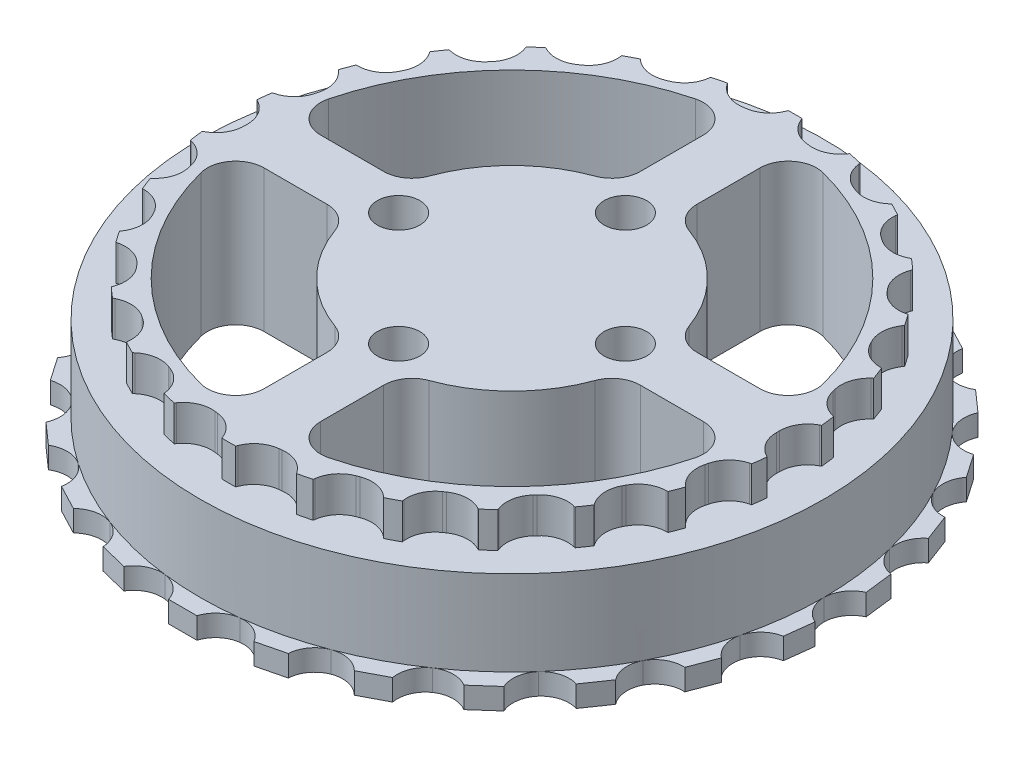
from build123d import *

# Parameters (mm, degrees)
SKETCH1_W                = 4
SKETCH1_H                = 4
BOSS_EXTRUDE1_DEPTH      = 10
FILLET1_R                = 2
BOSS_EXTRUDE2_DEPTH      = 1.5
FILLET2_R                = 2
CIRPATTERN1_COUNT        = 26
FILLET2_OF_CIRPATTERN1_R = 2
CUT_EXTRUDE1_START       = -2.5
CUT_EXTRUDE1_DEPTH       = 2.5
FILLET3_R                = 2
CIRPATTERN2_COUNT        = 26
FILLET3_OF_CIRPATTERN2_R = 2
SKETCH4_R                = 1.5
CUT_EXTRUDE2_DEPTH       = 2.75


with BuildPart() as part:
    # Sketch1 → Boss-Extrude1 (new body)
    with BuildSketch(Plane(origin=(0, 0, 0), x_dir=(1, 0, 0), z_dir=(0, 1, 0))):
        with BuildLine():
            ThreePointArc((2, -21.9089023), (15.556349186, -15.556349186), (21.9089023, -2))
            Line((21.9089023, -2), (17.88854382, -2))
            ThreePointArc((17.88854382, -2), (12.727922061, -12.727922061), (2, -17.88854382))
            Line((2, -17.88854382), (2, -21.9089023))
        make_face()
        with BuildLine():
            ThreePointArc((2, 21.9089023), (0, 22), (-2, 21.9089023))
            Line((-2, 21.9089023), (-2, 17.88854382))
            ThreePointArc((-2, 17.88854382), (0, 18), (2, 17.88854382))
            Line((2, 17.88854382), (2, 21.9089023))
        make_face()
        with BuildLine():
            Line((-2, -17.88854382), (-2, -21.9089023))
            ThreePointArc((-2, -21.9089023), (0, -22), (2, -21.9089023))
            Line((2, -21.9089023), (2, -17.88854382))
            ThreePointArc((2, -17.88854382), (0, -18), (-2, -17.88854382))
        make_face()
        with BuildLine():
            Line((-17.88854382, -2), (-21.9089023, -2))
            ThreePointArc((-21.9089023, -2), (-15.556349186, -15.556349186), (-2, -21.9089023))
            Line((-2, -21.9089023), (-2, -17.88854382))
            ThreePointArc((-2, -17.88854382), (-12.727922061, -12.727922061), (-17.88854382, -2))
        make_face()
        with BuildLine():
            Line((-17.88854382, 2), (-21.9089023, 2))
            ThreePointArc((-21.9089023, 2), (-22, 0), (-21.9089023, -2))
            Line((-21.9089023, -2), (-17.88854382, -2))
            ThreePointArc((-17.88854382, -2), (-18, 0), (-17.88854382, 2))
        make_face()
        with BuildLine():
            ThreePointArc((22, 0), (21.977213775, 1.001036811), (21.9089023, 2))
            Line((21.9089023, 2), (17.88854382, 2))
            ThreePointArc((17.88854382, 2), (17.972114355, 1.001551606), (18, 0))
            ThreePointArc((18, 0), (17.972114355, -1.001551606), (17.88854382, -2))
            Line((17.88854382, -2), (21.9089023, -2))
            ThreePointArc((21.9089023, -2), (21.977213775, -1.001036811), (22, 0))
        make_face()
        with BuildLine():
            Line((-2, 17.88854382), (-2, 21.9089023))
            ThreePointArc((-2, 21.9089023), (-15.556349186, 15.556349186), (-21.9089023, 2))
            Line((-21.9089023, 2), (-17.88854382, 2))
            ThreePointArc((-17.88854382, 2), (-12.727922061, 12.727922061), (-2, 17.88854382))
        make_face()
        with BuildLine():
            ThreePointArc((21.9089023, 2), (15.556349186, 15.556349186), (2, 21.9089023))
            Line((2, 21.9089023), (2, 17.88854382))
            ThreePointArc((2, 17.88854382), (12.727922061, 12.727922061), (17.88854382, 2))
            Line((17.88854382, 2), (21.9089023, 2))
        make_face()
        with BuildLine():
            ThreePointArc((2, 17.88854382), (0, 18), (-2, 17.88854382))
            Line((-2, 17.88854382), (-2, 9.542667342))
            ThreePointArc((-2, 9.542667342), (0, 9.75), (2, 9.542667342))
            Line((2, 9.542667342), (2, 17.88854382))
        make_face()
        with BuildLine():
            Line((-2, -9.542667342), (-2, -17.88854382))
            ThreePointArc((-2, -17.88854382), (0, -18), (2, -17.88854382))
            Line((2, -17.88854382), (2, -9.542667342))
            ThreePointArc((2, -9.542667342), (0, -9.75), (-2, -9.542667342))
        make_face()
        with BuildLine():
            Line((9.542667342, 2), (2, 2))
            Line((2, 2), (2, -2))
            Line((2, -2), (9.542667342, -2))
            ThreePointArc((9.542667342, -2), (9.69802832, -1.005358994), (9.75, 0))
            ThreePointArc((9.75, 0), (9.69802832, 1.005358994), (9.542667342, 2))
        make_face()
        with BuildLine():
            Line((2, -2), (-2, -2))
            Line((-2, -2), (-2, -9.542667342))
            ThreePointArc((-2, -9.542667342), (0, -9.75), (2, -9.542667342))
            Line((2, -9.542667342), (2, -2))
        make_face()
        with BuildLine():
            Line((-9.542667342, 2), (-17.88854382, 2))
            ThreePointArc((-17.88854382, 2), (-18, 0), (-17.88854382, -2))
            Line((-17.88854382, -2), (-9.542667342, -2))
            ThreePointArc((-9.542667342, -2), (-9.75, 0), (-9.542667342, 2))
        make_face()
        with BuildLine():
            ThreePointArc((18, 0), (17.972114355, 1.001551606), (17.88854382, 2))
            Line((17.88854382, 2), (9.542667342, 2))
            ThreePointArc((9.542667342, 2), (9.69802832, 1.005358994), (9.75, 0))
            ThreePointArc((9.75, 0), (9.69802832, -1.005358994), (9.542667342, -2))
            Line((9.542667342, -2), (17.88854382, -2))
            ThreePointArc((17.88854382, -2), (17.972114355, -1.001551606), (18, 0))
        make_face()
        with BuildLine():
            Line((9.542667342, -2), (2, -2))
            Line((2, -2), (2, -9.542667342))
            ThreePointArc((2, -9.542667342), (6.894291117, -6.894291117), (9.542667342, -2))
        make_face()
        with BuildLine():
            Line((-2, -9.542667342), (-2, -2))
            Line((-2, -2), (-9.542667342, -2))
            ThreePointArc((-9.542667342, -2), (-6.894291117, -6.894291117), (-2, -9.542667342))
        make_face()
        with BuildLine():
            Line((-2, -2), (-2, 2))
            Line((-2, 2), (-9.542667342, 2))
            ThreePointArc((-9.542667342, 2), (-9.75, 0), (-9.542667342, -2))
            Line((-9.542667342, -2), (-2, -2))
        make_face()
        with BuildLine():
            ThreePointArc((2, 9.542667342), (0, 9.75), (-2, 9.542667342))
            Line((-2, 9.542667342), (-2, 2))
            Line((-2, 2), (2, 2))
            Line((2, 2), (2, 9.542667342))
        make_face()
        Rectangle(SKETCH1_W, SKETCH1_H)
        with BuildLine():
            ThreePointArc((9.542667342, 2), (6.894291117, 6.894291117), (2, 9.542667342))
            Line((2, 9.542667342), (2, 2))
            Line((2, 2), (9.542667342, 2))
        make_face()
        with BuildLine():
            Line((-2, 2), (-2, 9.542667342))
            ThreePointArc((-2, 9.542667342), (-6.894291117, 6.894291117), (-9.542667342, 2))
            Line((-9.542667342, 2), (-2, 2))
        make_face()
    extrude(amount=BOSS_EXTRUDE1_DEPTH)

    # Fillet1
    fillet1_edges = [part.edges().sort_by_distance(p)[0] for p in [
        (17.88854382, 5, 2),
        (9.542667342, 5, 2),
        (2, 5, 9.542667342),
        (2, 5, 17.88854382),
        (2, 5, -9.542667342),
        (9.542667342, 5, -2),
        (17.88854382, 5, -2),
        (2, 5, -17.88854382),
        (-2, 5, 17.88854382),
        (-2, 5, 9.542667342),
        (-9.542667342, 5, 2),
        (-17.88854382, 5, 2),
        (-17.88854382, 5, -2),
        (-9.542667342, 5, -2),
        (-2, 5, -9.542667342),
        (-2, 5, -17.88854382),
    ]]
    fillet(fillet1_edges, radius=FILLET1_R)

    # Sketch2 → Boss-Extrude2 (add)
    with BuildSketch(Plane.XZ):
        with BuildLine():
            Line((1, 23.227260976), (-1, 23.227260976))
            Line((-1, 23.227260976), (-1, 21.977260976))
            ThreePointArc((-1, 21.977260976), (0, 22), (1, 21.977260976))
            Line((1, 21.977260976), (1, 23.227260976))
        make_face()
    boss_extrude2 = extrude(amount=-BOSS_EXTRUDE2_DEPTH)

    # Fillet2
    # the kernel refuses this fillet: 2 mm, written as the material it adds along each edge
    with BuildSketch(Plane(origin=(-1, 0, 21.977260976), x_dir=(-0.9965164866079756, 0, -0.0833959946190231), z_dir=(0, 1, 0))) as fillet2_piece_1:
        with BuildLine():
            CenterArc((1.748625289, 1.998554444), FILLET2_R, 202.11423331, 65.70722334)
            Line((-0.104244993, 1.245645608), (-0.141302399, 1.230587432))
            ThreePointArc((-0.141302399, 1.230587432), (-0.091983156, 0.619486964), (-0.039860659, -0.00333584))
            Line((-0.039860659, -0.00333584), (0.001520544, -0.039971089))
            ThreePointArc((0.001520544, -0.039971089), (0.836299051, -0.024098888), (1.671077559, -0.039971089))
            Line((1.671077559, -0.039971089), (1.672598103, 0))
        make_face()
    extrude(amount=1.5)
    with BuildSketch(Plane(origin=(1, 0, 21.977260976), x_dir=(0.9965164866079756, 0, -0.0833959946190233), z_dir=(0, 1, 0))) as fillet2_piece_2:
        with BuildLine():
            CenterArc((1.748625289, -1.998554444), FILLET2_R, 92.17854335, 65.70722334)
            Line((-0.104244993, -1.245645608), (-0.141302399, -1.230587432))
            ThreePointArc((-0.141302399, -1.230587432), (-0.091983156, -0.619486964), (-0.039860659, 0.00333584))
            Line((-0.039860659, 0.00333584), (0.001520544, 0.039971089))
            ThreePointArc((0.001520544, 0.039971089), (0.836299051, 0.024098888), (1.671077559, 0.039971089))
            Line((1.671077559, 0.039971089), (1.672598103, 0))
        make_face()
    extrude(amount=1.5)

    # CirPattern1: Boss-Extrude2 ×26 about axis
    cirpattern1_axis = Axis((0, 0, 0), (0, 1, 0))
    for i in range(1, CIRPATTERN1_COUNT):
        add(boss_extrude2.rotate(cirpattern1_axis, i * 360 / CIRPATTERN1_COUNT))

    # Fillet2 of CirPattern1
    # the kernel refuses this fillet: 2 mm, written as the material it adds along each edge
    with BuildSketch(Plane(origin=(4.288560992, 0, 21.577957378), x_dir=(-0.9875174964533451, 0, 0.1575093463846435), z_dir=(0, 1, 0)), Plane(origin=(9.327886408, 0, 19.92462133), x_dir=(-0.9211275788848948, 0, 0.389260816699616), z_dir=(0, 1, 0)), Plane(origin=(13.825108971, 0, 17.113338714), x_dir=(-0.8012050745941738, 0, 0.5983898632535017), z_dir=(0, 1, 0)), Plane(origin=(17.518866453, 0, 13.307491056), x_dir=(-0.634719443629989, 0, 0.7727426660137495), z_dir=(0, 1, 0)), Plane(origin=(20.194491095, 0, 8.728260389), x_dir=(-0.4313462257133342, 0, 0.902186473830583), z_dir=(0, 1, 0)), Plane(origin=(21.696485319, 0, 3.641774953), x_dir=(-0.20290473303795734, 0, 0.979198483102785), z_dir=(0, 1, 0)), Plane(origin=(21.937558679, 0, -1.656357205), x_dir=(0.03732884519289158, 0, 0.9993030357787197), z_dir=(0, 1, 0)), Plane(origin=(20.903700869, 0, -6.858227903), x_dir=(0.2753930066259576, 0, 0.9613317283339373), z_dir=(0, 1, 0)), Plane(origin=(18.654995946, 0, -11.661523324), x_dir=(0.4974523275267755, 0, 0.8674913151370414), z_dir=(0, 1, 0)), Plane(origin=(15.322130467, 0, -15.787093398), x_dir=(0.6906015273173737, 0, 0.7232354599070147), z_dir=(0, 1, 0)), Plane(origin=(11.098798459, 0, -18.995174986), x_dir=(0.8436154765747038, 0, 0.5369477886011221), z_dir=(0, 1, 0)), Plane(origin=(6.230444627, 0, -21.09932605), x_dir=(0.9476015607510001, 0, 0.31945466354753466), z_dir=(0, 1, 0)), Plane(origin=(1, 0, -21.977260976), x_dir=(0.9965164866079763, 0, 0.08339599461901703), z_dir=(0, 1, 0)), Plane(origin=(-4.288560992, 0, -21.577957378), x_dir=(0.9875174964533444, 0, -0.15750934638464753), z_dir=(0, 1, 0)), Plane(origin=(-9.327886408, 0, -19.92462133), x_dir=(0.9211275788848938, 0, -0.38926081669961826), z_dir=(0, 1, 0)), Plane(origin=(-13.825108971, 0, -17.113338714), x_dir=(0.8012050745941742, 0, -0.5983898632535011), z_dir=(0, 1, 0)), Plane(origin=(-17.518866453, 0, -13.307491056), x_dir=(0.6347194436299898, 0, -0.772742666013749), z_dir=(0, 1, 0)), Plane(origin=(-20.194491095, 0, -8.728260389), x_dir=(0.431346225713339, 0, -0.9021864738305808), z_dir=(0, 1, 0)), Plane(origin=(-21.696485319, 0, -3.641774953), x_dir=(0.20290473303796103, 0, -0.9791984831027842), z_dir=(0, 1, 0)), Plane(origin=(-21.937558679, 0, 1.656357205), x_dir=(-0.03732884519288293, 0, -0.99930303577872), z_dir=(0, 1, 0)), Plane(origin=(-20.903700869, 0, 6.858227903), x_dir=(-0.2753930066259506, 0, -0.9613317283339394), z_dir=(0, 1, 0)), Plane(origin=(-18.654995946, 0, 11.661523324), x_dir=(-0.49745232752677004, 0, -0.8674913151370446), z_dir=(0, 1, 0)), Plane(origin=(-15.322130467, 0, 15.787093398), x_dir=(-0.6906015273173698, 0, -0.7232354599070181), z_dir=(0, 1, 0)), Plane(origin=(-11.098798459, 0, 18.995174986), x_dir=(-0.8436154765746992, 0, -0.5369477886011296), z_dir=(0, 1, 0)), Plane(origin=(-6.230444627, 0, 21.09932605), x_dir=(-0.947601560750999, 0, -0.3194546635475381), z_dir=(0, 1, 0))) as fillet2_of_cirpattern1_piece_1:
        with BuildLine():
            CenterArc((1.748625289, 1.998554444), FILLET2_OF_CIRPATTERN1_R, 202.11423331, 65.70722334)
            Line((-0.104244993, 1.245645608), (-0.141302399, 1.230587432))
            ThreePointArc((-0.141302399, 1.230587432), (-0.091983156, 0.619486964), (-0.039860659, -0.00333584))
            Line((-0.039860659, -0.00333584), (0.001520544, -0.039971089))
            ThreePointArc((0.001520544, -0.039971089), (0.836299051, -0.024098888), (1.671077559, -0.039971089))
            Line((1.671077559, -0.039971089), (1.672598103, 0))
        make_face()
    extrude(amount=1.5)
    with BuildSketch(Plane(origin=(6.230444627, 0, 21.09932605), x_dir=(0.9476015607509982, 0, -0.3194546635475404), z_dir=(0, 1, 0)), Plane(origin=(11.098798459, 0, 18.995174986), x_dir=(0.8436154765747026, 0, -0.5369477886011241), z_dir=(0, 1, 0)), Plane(origin=(15.322130467, 0, 15.787093398), x_dir=(0.6906015273173723, 0, -0.7232354599070157), z_dir=(0, 1, 0)), Plane(origin=(18.654995946, 0, 11.661523324), x_dir=(0.4974523275267737, 0, -0.8674913151370424), z_dir=(0, 1, 0)), Plane(origin=(20.903700869, 0, 6.858227903), x_dir=(0.2753930066259588, 0, -0.9613317283339371), z_dir=(0, 1, 0)), Plane(origin=(21.937558679, 0, 1.656357205), x_dir=(0.037328845192891716, 0, -0.9993030357787197), z_dir=(0, 1, 0)), Plane(origin=(21.696485319, 0, -3.641774953), x_dir=(-0.20290473303795403, 0, -0.9791984831027857), z_dir=(0, 1, 0)), Plane(origin=(20.194491095, 0, -8.728260389), x_dir=(-0.43134622571333414, 0, -0.902186473830583), z_dir=(0, 1, 0)), Plane(origin=(17.518866453, 0, -13.307491056), x_dir=(-0.6347194436299866, 0, -0.7727426660137516), z_dir=(0, 1, 0)), Plane(origin=(13.825108971, 0, -17.113338714), x_dir=(-0.8012050745941711, 0, -0.5983898632535053), z_dir=(0, 1, 0)), Plane(origin=(9.327886408, 0, -19.92462133), x_dir=(-0.9211275788848943, 0, -0.38926081669961704), z_dir=(0, 1, 0)), Plane(origin=(4.288560992, 0, -21.577957378), x_dir=(-0.9875174964533442, 0, -0.15750934638464933), z_dir=(0, 1, 0)), Plane(origin=(-1, 0, -21.977260976), x_dir=(-0.996516486607976, 0, 0.08339599461901914), z_dir=(0, 1, 0)), Plane(origin=(-6.230444627, 0, -21.09932605), x_dir=(-0.9476015607509994, 0, 0.3194546635475369), z_dir=(0, 1, 0)), Plane(origin=(-11.098798459, 0, -18.995174986), x_dir=(-0.8436154765747029, 0, 0.5369477886011236), z_dir=(0, 1, 0)), Plane(origin=(-15.322130467, 0, -15.787093398), x_dir=(-0.6906015273173713, 0, 0.7232354599070168), z_dir=(0, 1, 0)), Plane(origin=(-18.654995946, 0, -11.661523324), x_dir=(-0.4974523275267707, 0, 0.8674913151370441), z_dir=(0, 1, 0)), Plane(origin=(-20.903700869, 0, -6.858227903), x_dir=(-0.2753930066259519, 0, 0.9613317283339391), z_dir=(0, 1, 0)), Plane(origin=(-21.937558679, 0, -1.656357205), x_dir=(-0.037328845192880995, 0, 0.9993030357787202), z_dir=(0, 1, 0)), Plane(origin=(-21.696485319, 0, 3.641774953), x_dir=(0.2029047330379618, 0, 0.9791984831027841), z_dir=(0, 1, 0)), Plane(origin=(-20.194491095, 0, 8.728260389), x_dir=(0.43134622571334064, 0, 0.9021864738305799), z_dir=(0, 1, 0)), Plane(origin=(-17.518866453, 0, 13.307491056), x_dir=(0.6347194436299933, 0, 0.772742666013746), z_dir=(0, 1, 0)), Plane(origin=(-13.825108971, 0, 17.113338714), x_dir=(0.8012050745941748, 0, 0.5983898632535004), z_dir=(0, 1, 0)), Plane(origin=(-9.327886408, 0, 19.92462133), x_dir=(0.9211275788848976, 0, 0.389260816699609), z_dir=(0, 1, 0)), Plane(origin=(-4.288560992, 0, 21.577957378), x_dir=(0.9875174964533451, 0, 0.15750934638464312), z_dir=(0, 1, 0))) as fillet2_of_cirpattern1_piece_2:
        with BuildLine():
            CenterArc((1.748625289, -1.998554444), FILLET2_OF_CIRPATTERN1_R, 92.17854335, 65.70722334)
            Line((-0.104244993, -1.245645608), (-0.141302399, -1.230587432))
            ThreePointArc((-0.141302399, -1.230587432), (-0.091983156, -0.619486964), (-0.039860659, 0.00333584))
            Line((-0.039860659, 0.00333584), (0.001520544, 0.039971089))
            ThreePointArc((0.001520544, 0.039971089), (0.836299051, 0.024098888), (1.671077559, 0.039971089))
            Line((1.671077559, 0.039971089), (1.672598103, 0))
        make_face()
    extrude(amount=1.5)

    # Sketch3 → Cut-Extrude1 (cut)
    with BuildSketch(Plane(origin=(0, 10, 0), x_dir=(1, 0, 0), z_dir=(0, 1, 0)).offset(CUT_EXTRUDE1_START)):
        with BuildLine():
            ThreePointArc((0, 20), (0.236315861, 19.998603822), (0.472598728, 19.994415481))
            Line((0.472598728, 19.994415481), (0.974339349, 18.724667229))
            ThreePointArc((0.974339349, 18.724667229), (2.247307757, 18.614835692), (3.509840592, 18.418564521))
            Line((3.509840592, 18.418564521), (4.29934642, 19.532424846))
            ThreePointArc((4.29934642, 19.532424846), (4.543184859, 19.477152547), (4.786313286, 19.418836349))
            Line((4.786313286, 19.418836349), (5.264944614, 21.360719983))
            ThreePointArc((5.264944614, 21.360719983), (2.651806966, 21.83959523), (0, 22))
            Line((0, 22), (0, 20))
        make_face()
    cut_extrude1 = extrude(amount=CUT_EXTRUDE1_DEPTH, mode=Mode.SUBTRACT)

    # Fillet3
    fillet3_edges = [part.edges().sort_by_distance(p)[0] for p in [
        (3.509840592, 8.75, -18.418564521),
        (0.974339349, 8.75, -18.724667229),
    ]]
    fillet(fillet3_edges, radius=FILLET3_R)

    # CirPattern2: Cut-Extrude1 ×26 about axis
    cirpattern2_axis = Axis((0, 0, 0), (0, 1, 0))
    for i in range(1, CIRPATTERN2_COUNT):
        add(cut_extrude1.rotate(cirpattern2_axis, i * 360 / CIRPATTERN2_COUNT), mode=Mode.SUBTRACT)

    # Fillet3 of CirPattern2
    fillet3_of_cirpattern2_edges = [part.edges().sort_by_distance(p)[0] for p in [
        (-1, 8.75, -18.723314343),
        (-3.535079358, 8.75, -18.413737098),
        (-5.451724227, 8.75, -17.939933192),
        (-7.839052103, 8.75, -17.032667499),
        (-9.586614058, 8.75, -16.113948333),
        (-11.687447633, 8.75, -14.661721176),
        (-13.164364727, 8.75, -13.351479369),
        (-14.856611188, 8.75, -11.438688911),
        (-15.977050367, 8.75, -9.813070955),
        (-17.162362503, 8.75, -7.550881625),
        (-17.861207915, 8.75, -5.704362525),
        (-18.470699692, 8.75, -3.224244544),
        (-18.707336981, 8.75, -1.26413728),
        (-18.705586953, 8.75, 1.289773909),
        (-18.466263621, 8.75, 3.249555028),
        (-17.853373493, 8.75, 5.728835391),
        (-17.151998141, 8.75, 7.57439501),
        (-15.963586859, 8.75, 9.834957783),
        (-14.840920874, 8.75, 11.459038686),
        (-13.146054582, 8.75, 13.369508178),
        (-11.66734323, 8.75, 14.677724686),
        (-9.564521397, 8.75, 16.127071353),
        (-7.815702007, 8.75, 17.043394678),
        (-5.427132994, 8.75, 17.947387761),
        (-3.509840592, 8.75, 18.418564521),
        (-0.974339349, 8.75, 18.724667229),
        (1, 8.75, 18.723314343),
        (3.535079358, 8.75, 18.413737098),
        (5.451724227, 8.75, 17.939933192),
        (7.839052103, 8.75, 17.032667499),
        (9.586614058, 8.75, 16.113948333),
        (11.687447633, 8.75, 14.661721176),
        (13.164364727, 8.75, 13.351479369),
        (14.856611188, 8.75, 11.438688911),
        (15.977050367, 8.75, 9.813070955),
        (17.162362503, 8.75, 7.550881625),
        (17.861207915, 8.75, 5.704362525),
        (18.470699692, 8.75, 3.224244544),
        (18.707336981, 8.75, 1.26413728),
        (18.705586953, 8.75, -1.289773909),
        (18.466263621, 8.75, -3.249555028),
        (17.853373493, 8.75, -5.728835391),
        (17.151998141, 8.75, -7.57439501),
        (15.963586859, 8.75, -9.834957783),
        (14.840920874, 8.75, -11.459038686),
        (13.146054582, 8.75, -13.369508178),
        (11.66734323, 8.75, -14.677724686),
        (9.564521397, 8.75, -16.127071353),
        (7.815702007, 8.75, -17.043394678),
        (5.427132994, 8.75, -17.947387761),
    ]]
    fillet(fillet3_of_cirpattern2_edges, radius=FILLET3_OF_CIRPATTERN2_R)

    # Sketch4 → Cut-Extrude2 (cut)
    with BuildSketch(Plane(origin=(0, 10, 0), x_dir=(1, 0, 0), z_dir=(0, 1, 0))):
        with Locations(Location((0, 8, 0), (0, 0, 270))):
            Circle(SKETCH4_R)
        with Locations(Location((0, -8, 0), (0, 0, 90))):
            Circle(SKETCH4_R)
        with Locations(Location((-8, 0, 0), (0, 0, 270))):
            Circle(SKETCH4_R)
        with Locations(Location((8, 0, 0), (0, 0, 90))):
            Circle(SKETCH4_R)
    extrude(amount=-CUT_EXTRUDE2_DEPTH, mode=Mode.SUBTRACT)


solid = part.part
